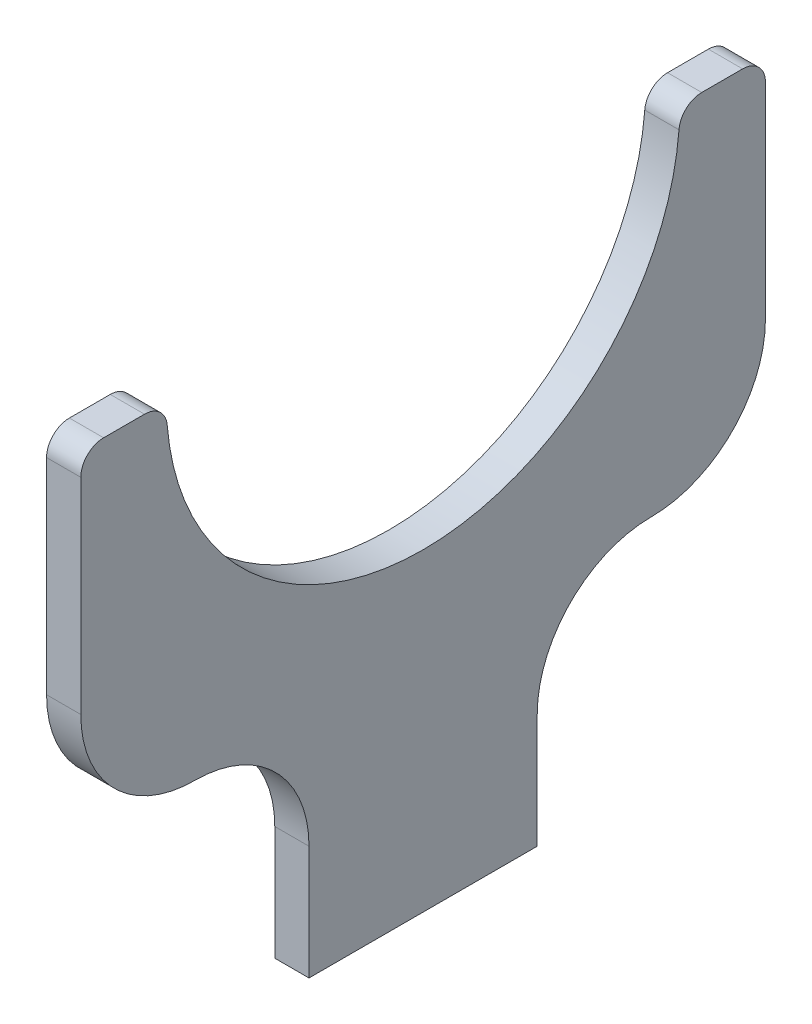
from build123d import *

# Parameters (mm, degrees)
SKETCH1_W           = 60
SKETCH1_H           = 50
BOSS_EXTRUDE1_DEPTH = 3
SKETCH2_W           = 20
SKETCH2_H           = 20
CUT_EXTRUDE1_DEPTH  = 3
SKETCH5_R           = 22.5
CUT_EXTRUDE2_DEPTH  = 3
FILLET1_DEPTH       = 3
FILLET1_2_DEPTH     = 3
FILLET2_R           = 2


with BuildPart() as part:
    # Sketch1 → Boss-Extrude1 (new body)
    with BuildSketch(Plane(origin=(0, 0, 0), x_dir=(0, 0, -1), z_dir=(1, 0, 0))):
        with Locations((30, 25)):
            Rectangle(SKETCH1_W, SKETCH1_H)
    extrude(amount=BOSS_EXTRUDE1_DEPTH)

    # Sketch2 → Cut-Extrude1 (cut)
    with BuildSketch(Plane(origin=(3, 0, 0), x_dir=(0, 0, -1), z_dir=(1, 0, 0))):
        with Locations((10, 10)):
            Rectangle(SKETCH2_W, SKETCH2_H)
        with Locations((50, 10)):
            Rectangle(SKETCH2_W, SKETCH2_H)
    extrude(amount=-CUT_EXTRUDE1_DEPTH, mode=Mode.SUBTRACT)

    # Sketch5 → Cut-Extrude2 (cut)
    with BuildSketch(Plane(origin=(3, 0, 0), x_dir=(0, 0, -1), z_dir=(1, 0, 0))):
        with Locations((30, 50)):
            Circle(SKETCH5_R)
    extrude(amount=-CUT_EXTRUDE2_DEPTH, mode=Mode.SUBTRACT)

    # Fillet1: read off the stored shape, not the designer's step
    # Fillet1 outline → Fillet1 (cut)
    with BuildSketch(Plane.YZ):
        with BuildLine():
            ThreePointArc((30, -60), (22.928932188, -57.071067812), (20, -50))
            Line((20, -50), (20, -60))
            Line((20, -60), (30, -60))
        make_face()
        with BuildLine():
            ThreePointArc((20, -10), (22.928932188, -2.928932188), (30, 0))
            Line((30, 0), (20, 0))
            Line((20, 0), (20, -10))
        make_face()
    extrude(amount=FILLET1_DEPTH, mode=Mode.SUBTRACT)

    # Fillet1 2 outline → Fillet1 2 (add)
    with BuildSketch(Plane.YZ):
        with BuildLine():
            ThreePointArc((10, -40), (17.071067812, -42.928932188), (20, -50))
            Line((20, -50), (20, -40))
            Line((20, -40), (10, -40))
        make_face()
        with BuildLine():
            Line((20, -20), (20, -10))
            ThreePointArc((20, -10), (17.071067812, -17.071067812), (10, -20))
            Line((10, -20), (20, -20))
        make_face()
    extrude(amount=FILLET1_2_DEPTH)

    # Fillet2
    fillet2_edges = [part.edges().sort_by_distance(p)[0] for p in [
        (1.5, 50, -52.5),
        (1.5, 50, -7.5),
        (1.5, 50, 0),
        (1.5, 50, -60),
    ]]
    fillet(fillet2_edges, radius=FILLET2_R)


solid = part.part
